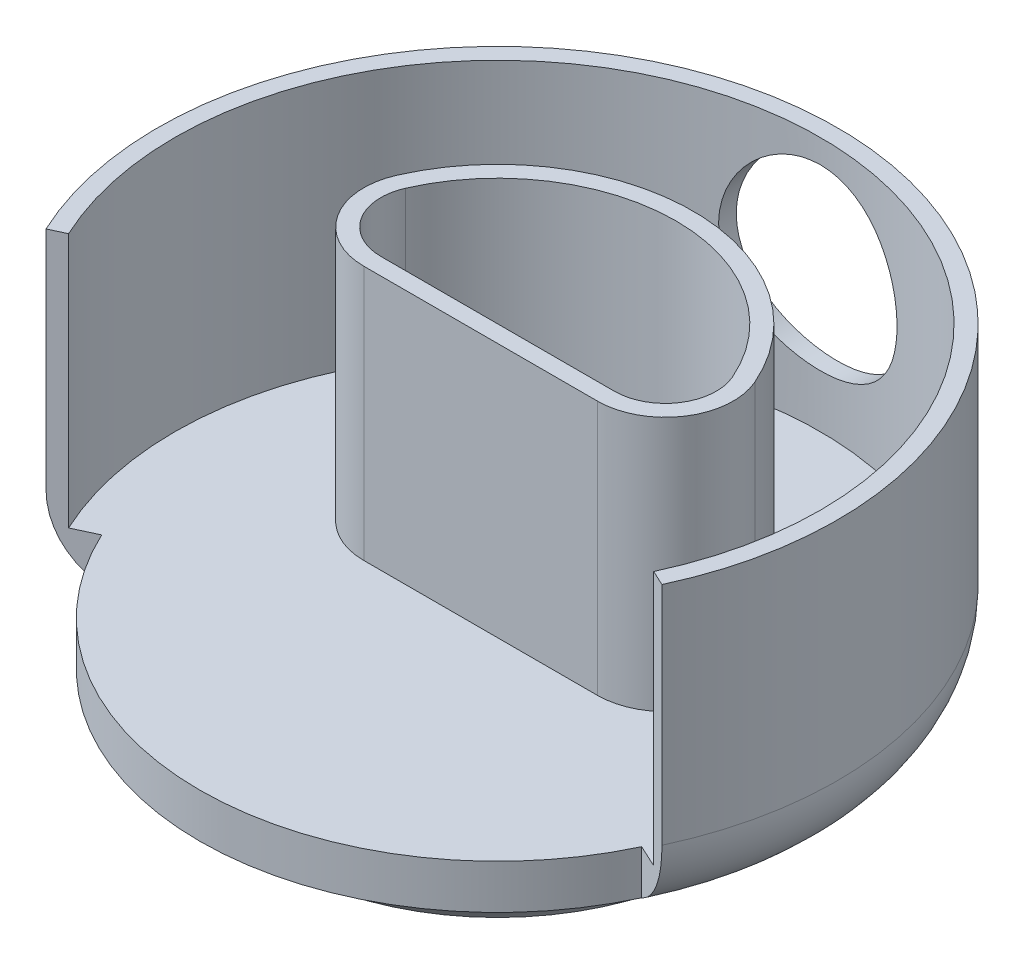
from build123d import *

# Parameters (mm, degrees)
CUT_EXTRUDE3_DEPTH           = 60
CUT_EXTRUDE5_DEPTH           = 2
CUT_EXTRUDE5_DEPTH_BACK      = 30
SKETCH9_R                    = 38
SKETCH9_R_2                  = 23
SKETCH19_W                   = 12
SKETCH19_H                   = 36.5
CUT_REVOLVE2_ANGLE           = 65
CUT_REVOLVE2_OTHER_WAY_ANGLE = 65
SKETCH21_W                   = 3.25
SKETCH21_H                   = 4
BOSS_EXTRUDE3_DEPTH          = 1.35
CIRPATTERN1_COUNT            = 5
CUT_EXTRUDE9_START           = -5
CUT_EXTRUDE9_DEPTH           = 5
SKETCH23_R                   = 10.5
CUT_EXTRUDE10_DEPTH          = 10
SKETCH24_W                   = 15
SKETCH24_H                   = 8
BOSS_EXTRUDE4_DEPTH          = 8
SKETCH26_W                   = 10
SKETCH26_H                   = 6
CUT_EXTRUDE11_DEPTH          = 10
SKETCH27_W                   = 4
SKETCH27_H                   = 5
CUT_EXTRUDE12_DEPTH          = 5
CUT_EXTRUDE14_DEPTH          = 2
CUT_EXTRUDE14_DEPTH_BACK     = 30
SKETCH29_R                   = 1
CUT_EXTRUDE15_DEPTH          = 15
FILLET1_R                    = 6
FILLET2_R                    = 8
INTERSECT2_START             = 55.427876097
INTERSECT2_OUTLINE_W         = 10
INTERSECT2_OUTLINE_H         = 6
INTERSECT2_DEPTH             = 8
INTERSECT2_2_DEPTH           = 13
INTERSECT2_START_2           = 50.427876097
INTERSECT2_3_OUTLINE_W       = 15
INTERSECT2_3_OUTLINE_H       = 8
INTERSECT2_3_OUTLINE_W_2     = 10
INTERSECT2_3_OUTLINE_H_2     = 6
INTERSECT2_3_DEPTH           = 5


# Read off the part's stored shape, not the designer's step: Cut-Extrude9, Intersect2
with BuildPart() as part:
    # Sketch1 → Revolve1 (revolve)
    with BuildSketch(Plane.XY, mode=Mode.PRIVATE) as revolve1_sk:
        with BuildLine():
            Line((0, 63.427876097), (32, 63.427876097))
            ThreePointArc((32, 63.427876097), (37.656854249, 61.084730346), (40, 55.427876097))
            Line((40, 55.427876097), (40, 28.846818009))
            ThreePointArc((40, 28.846818009), (38.792081772, 24.082439968), (35.460140376, 20.469057744))
            Line((35.460140376, 20.469057744), (28.539859624, 15.958818353))
            ThreePointArc((28.539859624, 15.958818353), (25.207918228, 12.345436129), (24, 7.581058088))
            Line((24, 7.581058088), (24, 3.25))
            Line((24, 3.25), (24.35, 3))
            Line((24.35, 3), (24.35, 0))
            Line((24.35, 0), (22.5, 0))
            Line((22.5, 0), (22.5, 12.5))
            ThreePointArc((22.5, 12.5), (22.353553391, 12.853553391), (22, 13))
            Line((22, 13), (0, 13))
            Line((0, 13), (0, 63.427876097))
        make_face()
    revolve(revolve1_sk.sketch.rotate(Axis((0, 0, 0), (0, 1, 0)), 90), axis=Axis((0, 0, 0), (0, 1, 0)))

    # Sketch11 → Cut-Extrude3 (cut)
    with BuildSketch(Plane(origin=(0, 13, 0), x_dir=(-1, 0, 0), z_dir=(0, -1, 0))):
        with BuildLine():
            Line((-21, 0), (21, 0))
            ThreePointArc((21, 0), (0, 21), (-21, 0))
        make_face()
    extrude(amount=-CUT_EXTRUDE3_DEPTH, mode=Mode.SUBTRACT)

    # Sketch9 → Cut-Extrude5 (cut, two sides: drawn at the far end of the back side and taken through both)
    with BuildSketch(Plane(origin=(0, 55.427876097, 0), x_dir=(1, 0, 0), z_dir=(0, 1, 0)).offset(-CUT_EXTRUDE5_DEPTH_BACK)):
        with Locations(Location((0, 0, 0), (0, 0, 270))):
            Circle(SKETCH9_R)
        with Locations(Location((0, 0, 0), (0, 0, 270))):
            Circle(SKETCH9_R_2, mode=Mode.SUBTRACT)
    extrude(amount=CUT_EXTRUDE5_DEPTH + CUT_EXTRUDE5_DEPTH_BACK, mode=Mode.SUBTRACT)

    # Sketch19 → Cut-Revolve2 (revolve, cut)
    with BuildSketch(Plane(origin=(0, 0, 0), x_dir=(0, 0, -1), z_dir=(1, 0, 0))):
        with Locations((-41.064715832, 37.177876097)):
            Rectangle(SKETCH19_W, SKETCH19_H)
    revolve(axis=Axis((0, 0, 0), (0, 1, 0)), revolution_arc=CUT_REVOLVE2_ANGLE, mode=Mode.SUBTRACT)

    # Sketch19 → Cut-Revolve2 other way (revolve, cut)
    with BuildSketch(Plane(origin=(0, 0, 0), x_dir=(0, 0, -1), z_dir=(1, 0, 0))):
        with Locations((-41.064715832, 37.177876097)):
            Rectangle(SKETCH19_W, SKETCH19_H)
    revolve(axis=Axis((0, 0, 0), (0, -1, 0)), revolution_arc=CUT_REVOLVE2_OTHER_WAY_ANGLE, mode=Mode.SUBTRACT)

    # Sketch21 → Boss-Extrude3 (add)
    with BuildSketch(Plane(origin=(0, 0, 22.5), x_dir=(-1, 0, 0), z_dir=(0, 0, -1))):
        with Locations((0, 2)):
            Rectangle(SKETCH21_W, SKETCH21_H)
    boss_extrude3 = extrude(amount=BOSS_EXTRUDE3_DEPTH)

    # CirPattern1: Boss-Extrude3 ×5 about axis
    cirpattern1_axis = Axis((0, 0, 0), (0, 1, 0))
    for i in range(1, CIRPATTERN1_COUNT):
        add(boss_extrude3.rotate(cirpattern1_axis, i * 360 / CIRPATTERN1_COUNT))

    # Cut-Extrude9 outline → Cut-Extrude9 (cut)
    with BuildSketch(Plane(origin=(0, 63.427876097, 0), x_dir=(1, 0, 0), z_dir=(0, 1, 0)).offset(CUT_EXTRUDE9_START)):
        with BuildLine():
            ThreePointArc((40, 0), (0, 40), (-40, 0))
            Line((-40, 0), (-21, 0))
            ThreePointArc((-21, 0), (0, 21), (21, 0))
            Line((21, 0), (40, 0))
        make_face()
    extrude(amount=CUT_EXTRUDE9_DEPTH, mode=Mode.SUBTRACT)

    # Sketch23 → Cut-Extrude10 (cut)
    with BuildSketch(Plane(origin=(0, 0, -40), x_dir=(-1, 0, 0), z_dir=(0, 0, -1))):
        with Locations((0, 42.137876097)):
            Circle(SKETCH23_R)
    extrude(amount=-CUT_EXTRUDE10_DEPTH, mode=Mode.SUBTRACT)

    # Sketch24 → Boss-Extrude4 (add)
    with BuildSketch(Plane(origin=(0, 58.427876097, 0), x_dir=(1, 0, 0), z_dir=(0, 1, 0))):
        with Locations((0, 30)):
            Rectangle(SKETCH24_W, SKETCH24_H)
    extrude(amount=-BOSS_EXTRUDE4_DEPTH)

    # Sketch26 → Cut-Extrude11 (cut)
    with BuildSketch(Plane(origin=(0, 58.427876097, 0), x_dir=(1, 0, 0), z_dir=(0, 1, 0))):
        with Locations((0, 30)):
            Rectangle(SKETCH26_W, SKETCH26_H)
    extrude(amount=-CUT_EXTRUDE11_DEPTH, mode=Mode.SUBTRACT)

    # Sketch27 → Cut-Extrude12 (cut)
    with BuildSketch(Plane(origin=(7.5, 0, 0), x_dir=(0, 0, -1), z_dir=(1, 0, 0))):
        with Locations((30, 53.927876097)):
            Rectangle(SKETCH27_W, SKETCH27_H)
    extrude(amount=-CUT_EXTRUDE12_DEPTH, mode=Mode.SUBTRACT)

    # Sketch28 → Cut-Extrude14 (cut, two sides: drawn at the far end of the back side and taken through both)
    with BuildSketch(Plane(origin=(0, 55.427876097, 0), x_dir=(1, 0, 0), z_dir=(0, 1, 0)).offset(-CUT_EXTRUDE14_DEPTH_BACK)):
        with BuildLine():
            Line((-22.912878475, -2), (22.912878475, -2))
            ThreePointArc((22.912878475, -2), (0, -23), (-22.912878475, -2))
        make_face()
    extrude(amount=CUT_EXTRUDE14_DEPTH + CUT_EXTRUDE14_DEPTH_BACK, mode=Mode.SUBTRACT)

    # Sketch29 → Cut-Extrude15 (cut)
    with BuildSketch(Plane(origin=(0, 0, 0), x_dir=(-1, 0, 0), z_dir=(0, 0, -1))):
        with Locations((-30.416198487, 60.927876097)):
            Circle(SKETCH29_R)
        with Locations((30.416198487, 60.927876097)):
            Circle(SKETCH29_R)
        with Locations((0, 60.927876097)):
            Circle(SKETCH29_R)
    extrude(amount=-CUT_EXTRUDE15_DEPTH, mode=Mode.SUBTRACT)

    # Fillet1
    fillet1_edges = [part.edges().sort_by_distance(p)[0] for p in [
        (21, 35.713938048, 0),
        (-21, 35.713938048, 0),
    ]]
    fillet(fillet1_edges, radius=FILLET1_R)

    # Fillet2
    fillet2_edges = [part.edges().sort_by_distance(p)[0] for p in [
        (-22.912878475, 41.427876097, 2),
        (22.912878475, 41.427876097, 2),
    ]]
    fillet(fillet2_edges, radius=FILLET2_R)

    # Intersect2 outline → Intersect2 (cut)
    with BuildSketch(Plane(origin=(0, 0, 0), x_dir=(1, 0, 0), z_dir=(0, 1, 0)).offset(INTERSECT2_START)):
        Polygon((-42, -15), (-40.906642577, -15), (-42, -15.355253362), (-42, -42), (42, -42), (42, -15.355253362), (40.906642577, -15), (42, -15), (42, 32), (25.257971351, 32), (32.523396625, 42), (-32.523396625, 42), (-25.257971351, 32), (-42, 32), align=None)
        with Locations((0, 30)):
            Rectangle(INTERSECT2_OUTLINE_W, INTERSECT2_OUTLINE_H, mode=Mode.SUBTRACT)
    extrude(amount=INTERSECT2_DEPTH, mode=Mode.SUBTRACT)

    # Intersect2 2 outline → Intersect2 2 (cut)
    with BuildSketch(Plane(origin=(0, 0, 0), x_dir=(1, 0, 0), z_dir=(0, 1, 0))):
        Polygon((-42, 28), (-42, -15), (-40.906642577, -15), (-42, -15.355253362), (-42, -42), (42, -42), (42, -15.355253362), (40.906642577, -15), (42, -15), (42, 28), (7.5, 28), (7.5, 26), (-7.5, 26), (-7.5, 28), align=None)
    extrude(amount=INTERSECT2_2_DEPTH, mode=Mode.SUBTRACT)

    # Intersect2 3 outline → Intersect2 3 (cut)
    with BuildSketch(Plane(origin=(0, 0, 0), x_dir=(1, 0, 0), z_dir=(0, 1, 0)).offset(INTERSECT2_START_2)):
        with Locations((0, 30)):
            Rectangle(INTERSECT2_3_OUTLINE_W, INTERSECT2_3_OUTLINE_H)
        with Locations((0, 30)):
            Rectangle(INTERSECT2_3_OUTLINE_W_2, INTERSECT2_3_OUTLINE_H_2, mode=Mode.SUBTRACT)
    extrude(amount=INTERSECT2_3_DEPTH, mode=Mode.SUBTRACT)


solid = part.part
